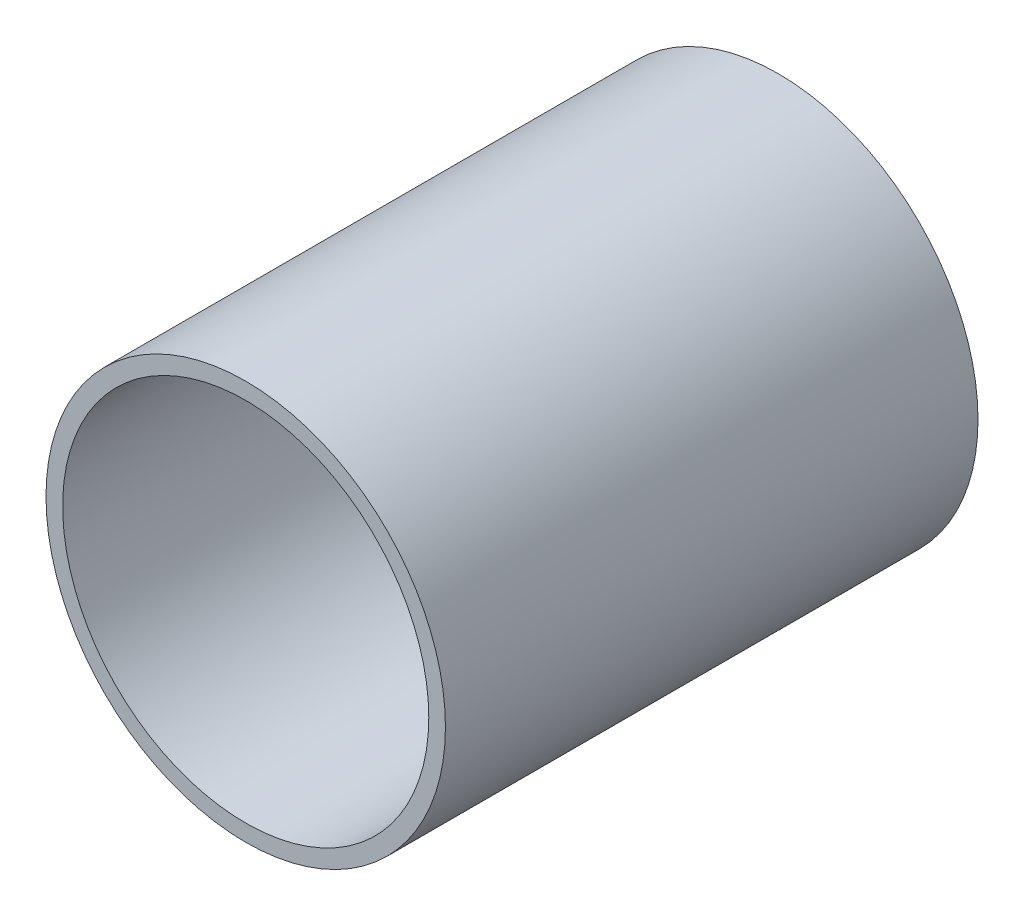
from build123d import *

# Parameters (mm, degrees)
SKETCH1_R           = 38.1
SKETCH1_R_2         = 34.925
BOSS_EXTRUDE1_DEPTH = 101.6


with BuildPart() as part:
    # Sketch1 → Boss-Extrude1 (new body)
    with BuildSketch(Plane.XY):
        Circle(SKETCH1_R)
        Circle(SKETCH1_R_2, mode=Mode.SUBTRACT)
    extrude(amount=BOSS_EXTRUDE1_DEPTH)


solid = part.part
